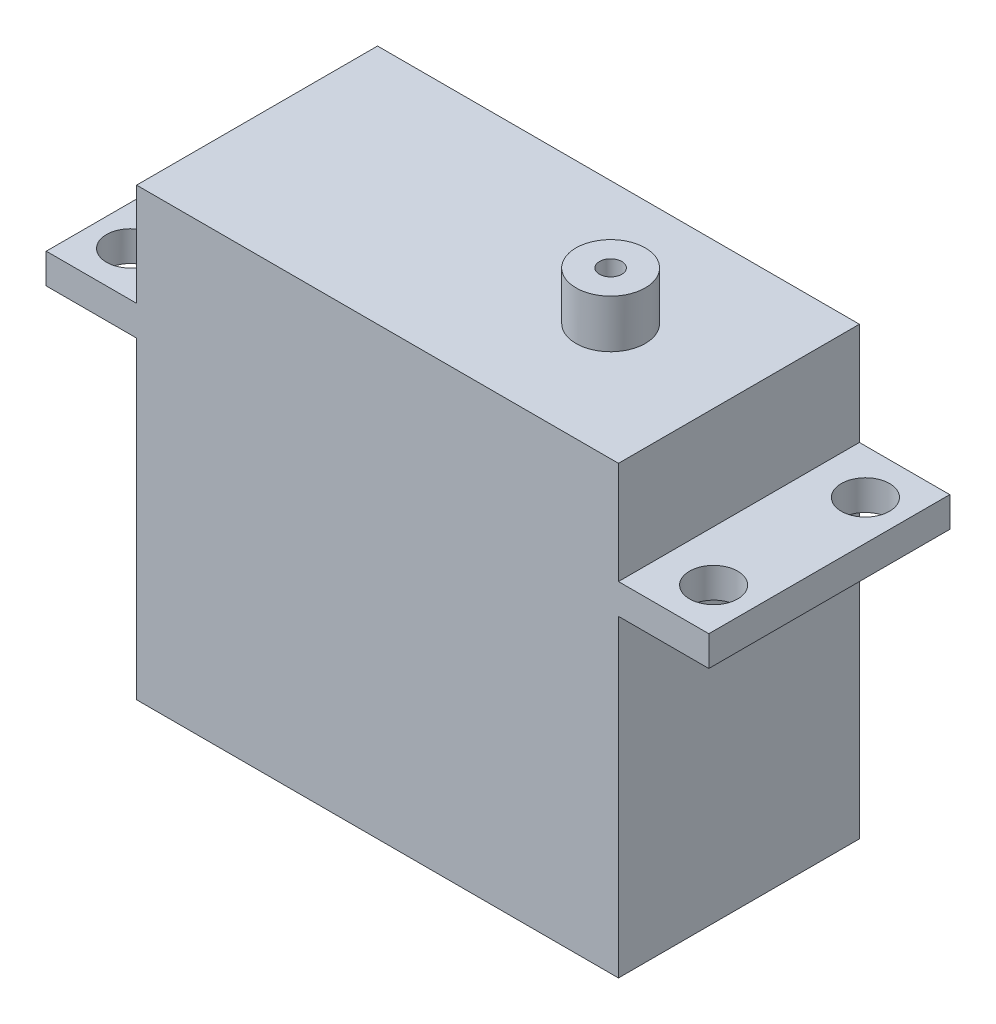
from build123d import *

# Parameters (mm, degrees)
SKETCH1_W                        = 40
SKETCH1_H                        = 20
BOSS_EXTRUDE1_DEPTH              = 37
SKETCH2_W                        = 7.5
SKETCH2_H                        = 20
BOSS_EXTRUDE2_DEPTH              = 2.5
F_4_0_4_DIAMETER_HOLE1_D         = 4
SKETCH5_R                        = 2.875
BOSS_EXTRUDE3_DEPTH              = 4
F_1_85_1_85_DIAMETER_HOLE1_D     = 1.85
F_1_85_1_85_DIAMETER_HOLE1_DEPTH = 4
F_1_85_1_85_DIAMETER_HOLE1_TIP   = 0.555796073


with BuildPart() as part:
    # Sketch1 → Boss-Extrude1 (new body)
    with BuildSketch(Plane(origin=(0, 0, 0), x_dir=(1, 0, 0), z_dir=(0, 1, 0))):
        Rectangle(SKETCH1_W, SKETCH1_H)
    extrude(amount=BOSS_EXTRUDE1_DEPTH)

    # Sketch2 → Boss-Extrude2 (add)
    with BuildSketch(Plane(origin=(0, 26, 0), x_dir=(1, 0, 0), z_dir=(0, 1, 0))):
        with Locations((23.75, 0)):
            Rectangle(SKETCH2_W, SKETCH2_H)
        with Locations((-23.75, 0)):
            Rectangle(SKETCH2_W, SKETCH2_H)
    extrude(amount=BOSS_EXTRUDE2_DEPTH)

    # Ø4.0 (4) Diameter Hole1 (through all)
    with Locations(Plane(origin=(0, 28.5, 0), x_dir=(1, 0, 0), z_dir=(0, 1, 0))):
        with Locations((-24.2, -6.3), (-24.2, 6.3), (24.2, 6.3), (24.2, -6.3)):
            Hole(F_4_0_4_DIAMETER_HOLE1_D / 2)

    # Sketch5 → Boss-Extrude3 (add)
    with BuildSketch(Plane(origin=(0, 37, 0), x_dir=(1, 0, 0), z_dir=(0, 1, 0))):
        with Locations((9.625, -0.275)):
            Circle(SKETCH5_R)
    extrude(amount=BOSS_EXTRUDE3_DEPTH)

    # Ø1.85 (1.85) Diameter Hole1
    with Locations(Plane(origin=(0, 41, 0), x_dir=(1, 0, 0), z_dir=(0, 1, 0))):
        with Locations((9.625, -0.275)):
            Hole(F_1_85_1_85_DIAMETER_HOLE1_D / 2, depth=F_1_85_1_85_DIAMETER_HOLE1_DEPTH)
            with Locations((0, 0, -(F_1_85_1_85_DIAMETER_HOLE1_DEPTH + F_1_85_1_85_DIAMETER_HOLE1_TIP / 2))):  # 118° drill point
                Cone(0, F_1_85_1_85_DIAMETER_HOLE1_D / 2, F_1_85_1_85_DIAMETER_HOLE1_TIP, mode=Mode.SUBTRACT)


solid = part.part
